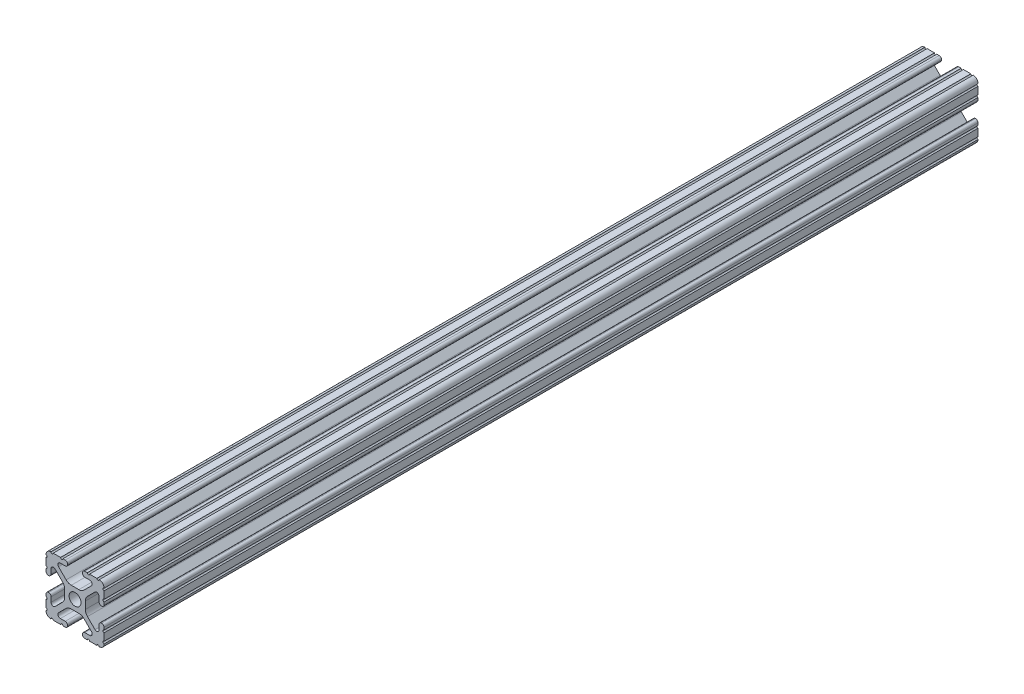
from build123d import *

# Parameters (mm, degrees)
SKETCH1_R           = 2.6035
BOSS_EXTRUDE1_DEPTH = 304.8
SKETCH2_W           = 33.577347781
SKETCH2_H           = 32.744851555
CUT_EXTRUDE1_DEPTH  = 227.33


with BuildPart() as part:
    # Sketch1 → Boss-Extrude1 (new, symmetric)
    with BuildSketch(Plane.XY):
        with BuildLine():
            Line((-7.179650497, -8.645192506), (-3.952270251, -5.423690499))
            ThreePointArc((-3.952270251, -5.423690499), (-2.922936451, -4.736929036), (-1.709253557, -4.4958))
            Line((-1.709253557, -4.4958), (1.709253557, -4.4958))
            ThreePointArc((1.709253557, -4.4958), (2.922936451, -4.736929036), (3.952270251, -5.423690499))
            Line((3.952270251, -5.423690499), (7.179650497, -8.645192506))
            ThreePointArc((7.179650497, -8.645192506), (7.41473083, -9.822813117), (6.416408329, -10.4902))
            Line((6.416408329, -10.4902), (4.287512407, -10.4902))
            ThreePointArc((4.287512407, -10.4902), (3.54574862, -10.79744862), (3.2385, -11.539212407))
            Line((3.2385, -11.539212407), (3.2385, -11.650987593))
            ThreePointArc((3.2385, -11.650987593), (3.54574862, -12.39275138), (4.287512407, -12.7))
            Line((4.287512407, -12.7), (5.317126718, -12.7))
            ThreePointArc((5.317126718, -12.7), (5.825126718, -12.192), (6.333126718, -12.7))
            Line((6.333126718, -12.7), (9.550443118, -12.7))
            ThreePointArc((9.550443118, -12.7), (10.058366869, -12.192000006), (10.566443095, -12.699847501))
            ThreePointArc((10.566443095, -12.699847501), (12.082537762, -12.08250727), (12.699846982, -10.566399977))
            ThreePointArc((12.699846982, -10.566399977), (12.192000006, -10.058323491), (12.7, -9.5504))
            Line((12.7, -9.5504), (12.7, -6.3330836))
            ThreePointArc((12.7, -6.3330836), (12.192, -5.8250836), (12.7, -5.3170836))
            Line((12.7, -5.3170836), (12.7, -4.287469289))
            ThreePointArc((12.7, -4.287469289), (12.39275138, -3.545705502), (11.650987593, -3.238456882))
            Line((11.650987593, -3.238456882), (11.539212407, -3.238456882))
            ThreePointArc((11.539212407, -3.238456882), (10.79744862, -3.545705502), (10.4902, -4.287469289))
            Line((10.4902, -4.287469289), (10.4902, -6.402089023))
            ThreePointArc((10.4902, -6.402089023), (9.856505071, -7.351067942), (8.737131347, -7.129408934))
            Line((8.737131347, -7.129408934), (5.441005833, -3.840816462))
            ThreePointArc((5.441005833, -3.840816462), (4.750877967, -2.809883091), (4.5085, -1.593185507))
            Line((4.5085, -1.593185507), (4.5085, 1.593185507))
            ThreePointArc((4.5085, 1.593185507), (4.750877967, 2.809883091), (5.441005833, 3.840816462))
            Line((5.441005833, 3.840816462), (8.737131347, 7.129408934))
            ThreePointArc((8.737131347, 7.129408934), (9.856505071, 7.351067942), (10.4902, 6.402089023))
            Line((10.4902, 6.402089023), (10.4902, 4.287469289))
            ThreePointArc((10.4902, 4.287469289), (10.79744862, 3.545705502), (11.539212407, 3.238456882))
            Line((11.539212407, 3.238456882), (11.650987593, 3.238456882))
            ThreePointArc((11.650987593, 3.238456882), (12.39275138, 3.545705502), (12.7, 4.287469289))
            Line((12.7, 4.287469289), (12.7, 5.3170836))
            ThreePointArc((12.7, 5.3170836), (12.192, 5.8250836), (12.7, 6.3330836))
            Line((12.7, 6.3330836), (12.7, 9.5504))
            ThreePointArc((12.7, 9.5504), (12.192000006, 10.058323491), (12.699846982, 10.566399977))
            ThreePointArc((12.699846982, 10.566399977), (12.082537762, 12.08250727), (10.566443095, 12.699847501))
            ThreePointArc((10.566443095, 12.699847501), (10.058366869, 12.192000006), (9.550443118, 12.7))
            Line((9.550443118, 12.7), (6.333126718, 12.7))
            ThreePointArc((6.333126718, 12.7), (5.825126718, 12.192), (5.317126718, 12.7))
            Line((5.317126718, 12.7), (4.287512407, 12.7))
            ThreePointArc((4.287512407, 12.7), (3.54574862, 12.39275138), (3.2385, 11.650987593))
            Line((3.2385, 11.650987593), (3.2385, 11.539212407))
            ThreePointArc((3.2385, 11.539212407), (3.54574862, 10.79744862), (4.287512407, 10.4902))
            Line((4.287512407, 10.4902), (6.476788598, 10.4902))
            ThreePointArc((6.476788598, 10.4902), (7.432222385, 9.85140422), (7.207036008, 8.724370562))
            Line((7.207036008, 8.724370562), (3.898272566, 5.423169045))
            ThreePointArc((3.898272566, 5.423169045), (2.869120213, 4.736787962), (1.655778399, 4.4958))
            Line((1.655778399, 4.4958), (-1.655778399, 4.4958))
            ThreePointArc((-1.655778399, 4.4958), (-2.869120213, 4.736787962), (-3.898272566, 5.423169045))
            Line((-3.898272566, 5.423169045), (-7.207036008, 8.724370562))
            ThreePointArc((-7.207036008, 8.724370562), (-7.432222385, 9.85140422), (-6.476788598, 10.4902))
            Line((-6.476788598, 10.4902), (-4.287512407, 10.4902))
            ThreePointArc((-4.287512407, 10.4902), (-3.54574862, 10.79744862), (-3.2385, 11.539212407))
            Line((-3.2385, 11.539212407), (-3.2385, 11.650987593))
            ThreePointArc((-3.2385, 11.650987593), (-3.54574862, 12.39275138), (-4.287512407, 12.7))
            Line((-4.287512407, 12.7), (-5.317126718, 12.7))
            ThreePointArc((-5.317126718, 12.7), (-5.825126718, 12.192), (-6.333126718, 12.7))
            Line((-6.333126718, 12.7), (-9.550443118, 12.7))
            ThreePointArc((-9.550443118, 12.7), (-10.058366869, 12.192000006), (-10.566443095, 12.699847501))
            ThreePointArc((-10.566443095, 12.699847501), (-12.082537762, 12.08250727), (-12.699846982, 10.566399977))
            ThreePointArc((-12.699846982, 10.566399977), (-12.192000006, 10.058323491), (-12.7, 9.5504))
            Line((-12.7, 9.5504), (-12.7, 6.3330836))
            ThreePointArc((-12.7, 6.3330836), (-12.192, 5.8250836), (-12.7, 5.3170836))
            Line((-12.7, 5.3170836), (-12.7, 4.287469289))
            ThreePointArc((-12.7, 4.287469289), (-12.39275138, 3.545705502), (-11.650987593, 3.238456882))
            Line((-11.650987593, 3.238456882), (-11.539212407, 3.238456882))
            ThreePointArc((-11.539212407, 3.238456882), (-10.79744862, 3.545705502), (-10.4902, 4.287469289))
            Line((-10.4902, 4.287469289), (-10.4902, 6.402089023))
            ThreePointArc((-10.4902, 6.402089023), (-9.856505071, 7.351067942), (-8.737131347, 7.129408934))
            Line((-8.737131347, 7.129408934), (-5.441005833, 3.840816462))
            ThreePointArc((-5.441005833, 3.840816462), (-4.750877967, 2.809883091), (-4.5085, 1.593185507))
            Line((-4.5085, 1.593185507), (-4.5085, -1.593185507))
            ThreePointArc((-4.5085, -1.593185507), (-4.750877967, -2.809883091), (-5.441005833, -3.840816462))
            Line((-5.441005833, -3.840816462), (-8.737131347, -7.129408934))
            ThreePointArc((-8.737131347, -7.129408934), (-9.856505071, -7.351067942), (-10.4902, -6.402089023))
            Line((-10.4902, -6.402089023), (-10.4902, -4.287469289))
            ThreePointArc((-10.4902, -4.287469289), (-10.79744862, -3.545705502), (-11.539212407, -3.238456882))
            Line((-11.539212407, -3.238456882), (-11.650987593, -3.238456882))
            ThreePointArc((-11.650987593, -3.238456882), (-12.39275138, -3.545705502), (-12.7, -4.287469289))
            Line((-12.7, -4.287469289), (-12.7, -5.3170836))
            ThreePointArc((-12.7, -5.3170836), (-12.192, -5.8250836), (-12.7, -6.3330836))
            Line((-12.7, -6.3330836), (-12.7, -9.5504))
            ThreePointArc((-12.7, -9.5504), (-12.192000006, -10.058323491), (-12.699846982, -10.566399977))
            ThreePointArc((-12.699846982, -10.566399977), (-12.082537762, -12.08250727), (-10.566443095, -12.699847501))
            ThreePointArc((-10.566443095, -12.699847501), (-10.058366869, -12.192000006), (-9.550443118, -12.7))
            Line((-9.550443118, -12.7), (-6.333126718, -12.7))
            ThreePointArc((-6.333126718, -12.7), (-5.825126718, -12.192), (-5.317126718, -12.7))
            Line((-5.317126718, -12.7), (-4.287512407, -12.7))
            ThreePointArc((-4.287512407, -12.7), (-3.54574862, -12.39275138), (-3.2385, -11.650987593))
            Line((-3.2385, -11.650987593), (-3.2385, -11.539212407))
            ThreePointArc((-3.2385, -11.539212407), (-3.54574862, -10.79744862), (-4.287512407, -10.4902))
            Line((-4.287512407, -10.4902), (-6.416408329, -10.4902))
            ThreePointArc((-6.416408329, -10.4902), (-7.41473083, -9.822813117), (-7.179650497, -8.645192506))
        make_face()
        Circle(SKETCH1_R, mode=Mode.SUBTRACT)
    extrude(amount=BOSS_EXTRUDE1_DEPTH, both=True)

    # Sketch2 → Cut-Extrude1 (cut)
    with BuildSketch(Plane.XY.offset(304.8)):
        with Locations((0.601247275, -1.572492872)):
            Rectangle(SKETCH2_W, SKETCH2_H)
    extrude(amount=-CUT_EXTRUDE1_DEPTH, mode=Mode.SUBTRACT)


solid = part.part
